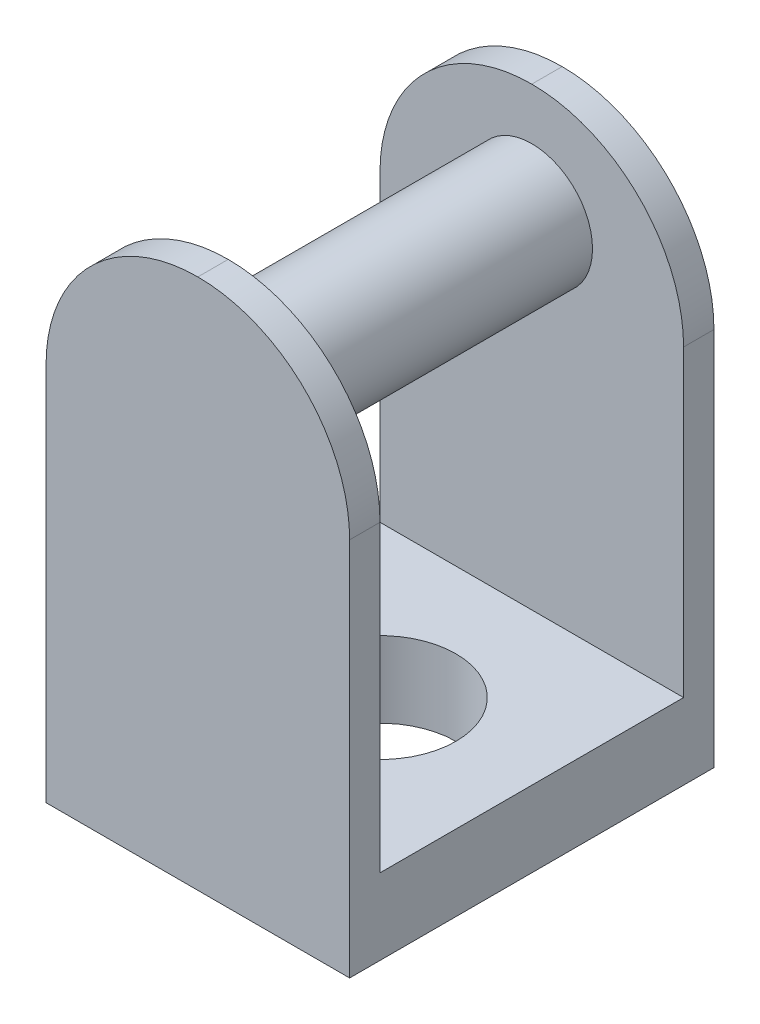
from build123d import *

# Parameters (mm, degrees)
SKETCH1_W                = 20
SKETCH1_H                = 20
SKETCH1_R                = 5
BOSS_EXTRUDE1_DEPTH      = 5
BOSS_EXTRUDE2_DEPTH      = 30
BOSS_EXTRUDE2_DEPTH_BACK = 5
SKETCH2_W                = 20
SKETCH2_H                = 2
FILLET1_R                = 10
SKETCH4_R                = 4
BOSS_EXTRUDE4_DEPTH      = 20


with BuildPart() as part:
    # Sketch1 → Boss-Extrude1 (new body)
    with BuildSketch(Plane(origin=(0, 0, 0), x_dir=(1, 0, 0), z_dir=(0, 1, 0))):
        Rectangle(SKETCH1_W, SKETCH1_H)
        with Locations(Location((0, 0, 0), (0, 0, 270))):
            Circle(SKETCH1_R, mode=Mode.SUBTRACT)
    extrude(amount=BOSS_EXTRUDE1_DEPTH)

    # Sketch2 → Boss-Extrude2 (add, two sides: drawn at the far end of the back side and taken through both)
    with BuildSketch(Plane(origin=(0, 5, 0), x_dir=(1, 0, 0), z_dir=(0, 1, 0)).offset(-BOSS_EXTRUDE2_DEPTH_BACK)):
        with Locations((0, -11)):
            Rectangle(SKETCH2_W, SKETCH2_H)
        with Locations((0, 11)):
            Rectangle(SKETCH2_W, SKETCH2_H)
    extrude(amount=BOSS_EXTRUDE2_DEPTH + BOSS_EXTRUDE2_DEPTH_BACK)

    # Fillet1
    fillet1_edges = [part.edges().sort_by_distance(p)[0] for p in [
        (10, 35, -11),
        (10, 35, 11),
        (-10, 35, 11),
        (-10, 35, -11),
    ]]
    fillet(fillet1_edges, radius=FILLET1_R - 0.0001)  # a hair under: the kernel refuses the full size

    # Sketch4 → Boss-Extrude4 (add)
    with BuildSketch(Plane(origin=(0, 0, 10), x_dir=(-1, 0, 0), z_dir=(0, 0, -1))):
        with Locations(Location((0, 27.604071929, 0), (0, 0, 180))):
            Circle(SKETCH4_R)
    extrude(amount=BOSS_EXTRUDE4_DEPTH)


solid = part.part
